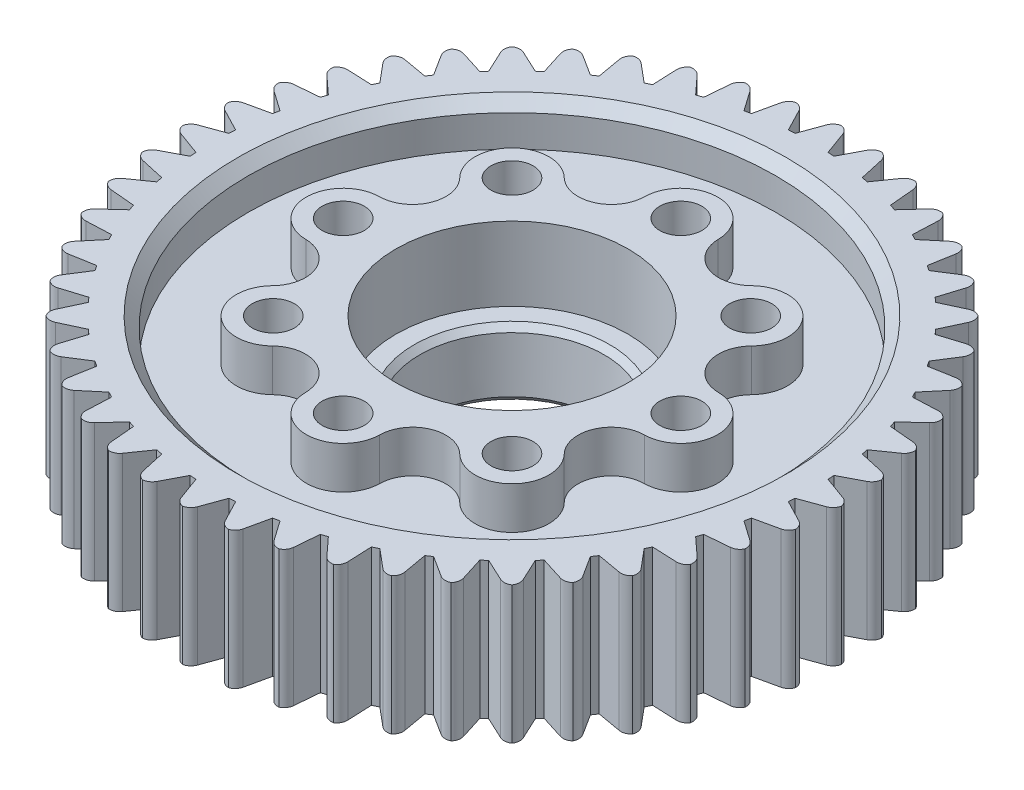
from build123d import *
from OCP.BRepFilletAPI import BRepFilletAPI_MakeChamfer

# Parameters (mm, degrees)
BOSS_EXTRUDE1_DEPTH      = 13
FILLET1_R                = 1
CIRPATTERN1_COUNT        = 48
FILLET1_OF_CIRPATTERN1_R = 1
CUT_EXTRUDE1_DEPTH       = 47.043877534
CUT_EXTRUDE1_DEPTH_BACK  = 47.043877534
SKETCH2_R                = 8.25
SKETCH2_3_R              = 11
SKETCH2_3_R_2            = 8.25
CUT_EXTRUDE2_DEPTH       = 7
SKETCH4_R                = 2
CUT_EXTRUDE4_DEPTH       = 47.043877534
CIRPATTERN2_COUNT        = 8
SKETCH9_R                = 25
CUT_EXTRUDE13_DEPTH      = 4
CHAMFER1_SIZE            = 0.5
CHAMFER1_SIZE2           = 0.461531173
CHAMFER1_SIZE2_2         = 0.550031434
CHAMFER2_SIZE            = 1


# Read off the part's stored shape, not the designer's step: Draft1
with BuildPart() as part:
    # Sketch1 → Boss-Extrude1 (new body)
    with BuildSketch(Plane(origin=(0, 0, 0), x_dir=(1, 0, 0), z_dir=(0, 1, 0))):
        with BuildLine():
            Line((1.560192225, 28.394668628), (0.522526729, 31.245631148))
            ThreePointArc((0.522526729, 31.245631148), (0, 31.25), (-0.522526729, 31.245631148))
            Line((-0.522526729, 31.245631148), (-1.560192225, 28.394668628))
            ThreePointArc((-1.560192225, 28.394668628), (-1.861230023, 28.376526022), (-2.162058489, 28.355191929))
            Line((-2.162058489, 28.355191929), (0, 0))
            Line((0, 0), (1.560192225, 28.394668628))
        make_face()
    boss_extrude1 = extrude(amount=BOSS_EXTRUDE1_DEPTH)

    # Fillet1
    # the kernel refuses this fillet: 1 mm, written as the material it takes off along each edge
    with BuildSketch(Plane(origin=(-0.522526729, -1.768837485, -31.245631148), x_dir=(0.9999854155376374, 0, -0.00540080660816087), z_dir=(0, 1, 0))) as fillet1_piece_1:
        with BuildLine():
            CenterArc((0.696214434, -0.99993592), FILLET1_R, 89.351365841, 70.33918923)
            Line((-0.241617297, -0.652845667), (0, 0))
            ThreePointArc((0, 0), (0.353767497, 0.002002487), (0.707534994, 0))
        make_face()
    extrude(amount=16.537674971, mode=Mode.SUBTRACT)
    with BuildSketch(Plane(origin=(0.522526729, -1.768837485, -31.245631148), x_dir=(0.3420201433256663, 0, 0.9396926207859093), z_dir=(0, 1, 0))) as fillet1_piece_2:
        with BuildLine():
            CenterArc((0.696122391, -1), FILLET1_R, 90, 70.33918923)
            ThreePointArc((-0.2455785, -0.663548768), (-0.124667246, -0.33107934), (0, 0))
            Line((0, 0), (0.696122391, 0))
        make_face()
    extrude(amount=16.537674971, mode=Mode.SUBTRACT)

    # CirPattern1: Boss-Extrude1 ×48 about axis
    cirpattern1_axis = Axis((0, 0, 0), (0, 1, 0))
    for i in range(1, CIRPATTERN1_COUNT):
        add(boss_extrude1.rotate(cirpattern1_axis, i * 360 / CIRPATTERN1_COUNT))

    # Fillet1 of CirPattern1
    # the kernel refuses this fillet: 1 mm, written as the material it takes off along each edge
    with BuildSketch(Plane(origin=(-4.596429698, -1.768837485, -30.910117017), x_dir=(-0.21643961393809757, 0, 0.9762960071199345), z_dir=(0, 1, 0)), Plane(origin=(-8.59168648, -1.768837485, -30.045722215), x_dir=(-0.08715574274765552, 0, 0.9961946980917458), z_dir=(0, 1, 0)), Plane(origin=(-12.439937124, -1.768837485, -28.667236776), x_dir=(0.043619387365339504, 0, 0.9990482215818576), z_dir=(0, 1, 0)), Plane(origin=(-16.075336995, -1.768837485, -26.798246967), x_dir=(0.17364817766693452, 0, 0.9848077530122074), z_dir=(0, 1, 0)), Plane(origin=(-19.435683394, -1.768837485, -24.470731722), x_dir=(0.3007057995042772, 0, 0.9537169507482257), z_dir=(0, 1, 0)), Plane(origin=(-22.46347986, -1.768837485, -21.724515474), x_dir=(0.422618261740705, 0, 0.9063077870366474), z_dir=(0, 1, 0)), Plane(origin=(-25.106919959, -1.768837485, -18.606586742), x_dir=(0.5372996083468274, 0, 0.8433914458128834), z_dir=(0, 1, 0)), Plane(origin=(-27.320773696, -1.768837485, -15.170294152), x_dir=(0.6427876096865415, 0, 0.7660444431189763), z_dir=(0, 1, 0)), Plane(origin=(-29.06716142, -1.768837485, -11.474433624), x_dir=(0.7372773368101273, 0, 0.6755902076156568), z_dir=(0, 1, 0)), Plane(origin=(-30.316201953, -1.768837485, -7.582242355), x_dir=(0.8191520442889958, 0, 0.5735764363510405), z_dir=(0, 1, 0)), Plane(origin=(-31.046523866, -1.768837485, -3.560316817), x_dir=(0.8870108331782227, 0, 0.46174861323503186), z_dir=(0, 1, 0)), Plane(origin=(-31.245631148, -1.768837485, 0.522526729), x_dir=(0.9396926207859095, 0, 0.3420201433256653), z_dir=(0, 1, 0)), Plane(origin=(-30.910117017, -1.768837485, 4.596429698), x_dir=(0.9762960071199345, 0, 0.21643961393809757), z_dir=(0, 1, 0)), Plane(origin=(-30.045722215, -1.768837485, 8.59168648), x_dir=(0.9961946980917459, 0, 0.08715574274765424), z_dir=(0, 1, 0)), Plane(origin=(-28.667236776, -1.768837485, 12.439937124), x_dir=(0.9990482215818577, 0, -0.04361938736533951), z_dir=(0, 1, 0)), Plane(origin=(-26.798246967, -1.768837485, 16.075336995), x_dir=(0.9848077530122079, 0, -0.17364817766693058), z_dir=(0, 1, 0)), Plane(origin=(-24.470731722, -1.768837485, 19.435683394), x_dir=(0.953716950748225, 0, -0.3007057995042789), z_dir=(0, 1, 0)), Plane(origin=(-21.724515474, -1.768837485, 22.46347986), x_dir=(0.9063077870366485, 0, -0.4226182617407028), z_dir=(0, 1, 0)), Plane(origin=(-18.606586742, -1.768837485, 25.106919959), x_dir=(0.8433914458128834, 0, -0.5372996083468274), z_dir=(0, 1, 0)), Plane(origin=(-15.170294152, -1.768837485, 27.320773696), x_dir=(0.7660444431189748, 0, -0.6427876096865431), z_dir=(0, 1, 0)), Plane(origin=(-11.474433624, -1.768837485, 29.06716142), x_dir=(0.6755902076156569, 0, -0.737277336810127), z_dir=(0, 1, 0)), Plane(origin=(-7.582242355, -1.768837485, 30.316201953), x_dir=(0.5735764363510443, 0, -0.8191520442889931), z_dir=(0, 1, 0)), Plane(origin=(-3.560316817, -1.768837485, 31.046523866), x_dir=(0.4617486132350302, 0, -0.8870108331782236), z_dir=(0, 1, 0)), Plane(origin=(0.522526729, -1.768837485, 31.245631148), x_dir=(0.3420201433256653, 0, -0.9396926207859095), z_dir=(0, 1, 0)), Plane(origin=(4.596429698, -1.768837485, 30.910117017), x_dir=(0.21643961393810002, 0, -0.976296007119934), z_dir=(0, 1, 0)), Plane(origin=(8.59168648, -1.768837485, 30.045722215), x_dir=(0.08715574274765468, 0, -0.9961946980917459), z_dir=(0, 1, 0)), Plane(origin=(12.439937124, -1.768837485, 28.667236776), x_dir=(-0.043619387365339726, 0, -0.9990482215818576), z_dir=(0, 1, 0)), Plane(origin=(16.075336995, -1.768837485, 26.798246967), x_dir=(-0.17364817766693363, 0, -0.9848077530122074), z_dir=(0, 1, 0)), Plane(origin=(19.435683394, -1.768837485, 24.470731722), x_dir=(-0.3007057995042743, 0, -0.9537169507482266), z_dir=(0, 1, 0)), Plane(origin=(22.46347986, -1.768837485, 21.724515474), x_dir=(-0.4226182617406989, 0, -0.9063077870366503), z_dir=(0, 1, 0)), Plane(origin=(25.106919959, -1.768837485, 18.606586742), x_dir=(-0.5372996083468274, 0, -0.8433914458128834), z_dir=(0, 1, 0)), Plane(origin=(27.320773696, -1.768837485, 15.170294152), x_dir=(-0.6427876096865437, 0, -0.7660444431189745), z_dir=(0, 1, 0)), Plane(origin=(29.06716142, -1.768837485, 11.474433624), x_dir=(-0.737277336810127, 0, -0.6755902076156569), z_dir=(0, 1, 0)), Plane(origin=(30.316201953, -1.768837485, 7.582242355), x_dir=(-0.8191520442889937, 0, -0.5735764363510434), z_dir=(0, 1, 0)), Plane(origin=(31.046523866, -1.768837485, 3.560316817), x_dir=(-0.8870108331782238, 0, -0.46174861323502986), z_dir=(0, 1, 0)), Plane(origin=(31.245631148, -1.768837485, -0.522526729), x_dir=(-0.9396926207859091, 0, -0.34202014332566666), z_dir=(0, 1, 0)), Plane(origin=(30.910117017, -1.768837485, -4.596429698), x_dir=(-0.976296007119934, 0, -0.21643961393810002), z_dir=(0, 1, 0)), Plane(origin=(30.045722215, -1.768837485, -8.59168648), x_dir=(-0.9961946980917458, 0, -0.08715574274765596), z_dir=(0, 1, 0)), Plane(origin=(28.667236776, -1.768837485, -12.439937124), x_dir=(-0.9990482215818577, 0, 0.04361938736533973), z_dir=(0, 1, 0)), Plane(origin=(26.798246967, -1.768837485, -16.075336995), x_dir=(-0.9848077530122077, 0, 0.1736481776669322), z_dir=(0, 1, 0)), Plane(origin=(24.470731722, -1.768837485, -19.435683394), x_dir=(-0.9537169507482254, 0, 0.3007057995042779), z_dir=(0, 1, 0)), Plane(origin=(21.724515474, -1.768837485, -22.46347986), x_dir=(-0.9063077870366483, 0, 0.42261826174070305), z_dir=(0, 1, 0)), Plane(origin=(18.606586742, -1.768837485, -25.106919959), x_dir=(-0.8433914458128843, 0, 0.5372996083468261), z_dir=(0, 1, 0)), Plane(origin=(15.170294152, -1.768837485, -27.320773696), x_dir=(-0.7660444431189768, 0, 0.6427876096865409), z_dir=(0, 1, 0)), Plane(origin=(11.474433624, -1.768837485, -29.06716142), x_dir=(-0.6755902076156592, 0, 0.7372773368101249), z_dir=(0, 1, 0)), Plane(origin=(7.582242355, -1.768837485, -30.316201953), x_dir=(-0.5735764363510422, 0, 0.8191520442889946), z_dir=(0, 1, 0)), Plane(origin=(3.560316817, -1.768837485, -31.046523866), x_dir=(-0.46174861323503036, 0, 0.8870108331782236), z_dir=(0, 1, 0))) as fillet1_of_cirpattern1_piece_1:
        with BuildLine():
            CenterArc((0.696122391, 1), FILLET1_OF_CIRPATTERN1_R, 199.66081077, 70.33918923)
            ThreePointArc((-0.2455785, 0.663548768), (-0.124667246, 0.33107934), (0, 0))
            Line((0, 0), (0.696122391, 0))
        make_face()
    extrude(amount=16.537674971, mode=Mode.SUBTRACT)
    with BuildSketch(Plane(origin=(-3.560316817, -1.768837485, -31.046523866), x_dir=(-0.9921353484050245, 0, 0.12516968660678457), z_dir=(0, 1, 0)), Plane(origin=(-7.582242355, -1.768837485, -30.316201953), x_dir=(-0.9673095703893142, 0, 0.2535984917802955), z_dir=(0, 1, 0)), Plane(origin=(-11.474433624, -1.768837485, -29.06716142), x_dir=(-0.9259328574353646, 0, 0.3776881564486512), z_dir=(0, 1, 0)), Plane(origin=(-15.170294152, -1.768837485, -27.320773696), x_dir=(-0.8687131765736099, 0, 0.495315472045229), z_dir=(0, 1, 0)), Plane(origin=(-18.606586742, -1.768837485, -25.106919959), x_dir=(-0.7966295724078818, 0, 0.6044678025877271), z_dir=(0, 1, 0)), Plane(origin=(-21.724515474, -1.768837485, -22.46347986), x_dir=(-0.7109154153908119, 0, 0.7032775214378099), z_dir=(0, 1, 0)), Plane(origin=(-24.470731722, -1.768837485, -19.435683394), x_dir=(-0.6130372985134128, 0, 0.7900539669107274), z_dir=(0, 1, 0)), Plane(origin=(-26.798246967, -1.768837485, -16.075336995), x_dir=(-0.5046699434924125, 0, 0.8633123699654519), z_dir=(0, 1, 0)), Plane(origin=(-28.667236776, -1.768837485, -12.439937124), x_dir=(-0.3876675458172975, 0, 0.9217992590146694), z_dir=(0, 1, 0)), Plane(origin=(-30.045722215, -1.768837485, -8.59168648), x_dir=(-0.26403204895151144, 0, 0.9645139071711027), z_dir=(0, 1, 0)), Plane(origin=(-30.910117017, -1.768837485, -4.596429698), x_dir=(-0.1358788905246371, 0, 0.9907254549620665), z_dir=(0, 1, 0)), Plane(origin=(-31.245631148, -1.768837485, -0.522526729), x_dir=(-0.00540080660815091, 0, 0.9999854155376374), z_dir=(0, 1, 0)), Plane(origin=(-31.046523866, -1.768837485, 3.560316817), x_dir=(0.12516968660678457, 0, 0.9921353484050245), z_dir=(0, 1, 0)), Plane(origin=(-30.316201953, -1.768837485, 7.582242355), x_dir=(0.25359849178029426, 0, 0.9673095703893144), z_dir=(0, 1, 0)), Plane(origin=(-29.06716142, -1.768837485, 11.474433624), x_dir=(0.3776881564486521, 0, 0.9259328574353642), z_dir=(0, 1, 0)), Plane(origin=(-27.320773696, -1.768837485, 15.170294152), x_dir=(0.4953154720452301, 0, 0.8687131765736092), z_dir=(0, 1, 0)), Plane(origin=(-25.106919959, -1.768837485, 18.606586742), x_dir=(0.6044678025877279, 0, 0.7966295724078812), z_dir=(0, 1, 0)), Plane(origin=(-22.46347986, -1.768837485, 21.724515474), x_dir=(0.7032775214378076, 0, 0.7109154153908143), z_dir=(0, 1, 0)), Plane(origin=(-19.435683394, -1.768837485, 24.470731722), x_dir=(0.7900539669107263, 0, 0.6130372985134143), z_dir=(0, 1, 0)), Plane(origin=(-16.075336995, -1.768837485, 26.798246967), x_dir=(0.8633123699654537, 0, 0.5046699434924091), z_dir=(0, 1, 0)), Plane(origin=(-12.439937124, -1.768837485, 28.667236776), x_dir=(0.9217992590146694, 0, 0.3876675458172975), z_dir=(0, 1, 0)), Plane(origin=(-8.59168648, -1.768837485, 30.045722215), x_dir=(0.9645139071711034, 0, 0.2640320489515087), z_dir=(0, 1, 0)), Plane(origin=(-4.596429698, -1.768837485, 30.910117017), x_dir=(0.9907254549620664, 0, 0.1358788905246376), z_dir=(0, 1, 0)), Plane(origin=(-0.522526729, -1.768837485, 31.245631148), x_dir=(0.9999854155376374, 0, 0.005400806608150907), z_dir=(0, 1, 0)), Plane(origin=(3.560316817, -1.768837485, 31.046523866), x_dir=(0.9921353484050245, 0, -0.12516968660678457), z_dir=(0, 1, 0)), Plane(origin=(7.582242355, -1.768837485, 30.316201953), x_dir=(0.9673095703893142, 0, -0.25359849178029514), z_dir=(0, 1, 0)), Plane(origin=(11.474433624, -1.768837485, 29.06716142), x_dir=(0.9259328574353635, 0, -0.37768815644865383), z_dir=(0, 1, 0)), Plane(origin=(15.170294152, -1.768837485, 27.320773696), x_dir=(0.8687131765736092, 0, -0.49531547204523013), z_dir=(0, 1, 0)), Plane(origin=(18.606586742, -1.768837485, 25.106919959), x_dir=(0.7966295724078818, 0, -0.6044678025877271), z_dir=(0, 1, 0)), Plane(origin=(21.724515474, -1.768837485, 22.46347986), x_dir=(0.7109154153908143, 0, -0.7032775214378076), z_dir=(0, 1, 0)), Plane(origin=(24.470731722, -1.768837485, 19.435683394), x_dir=(0.6130372985134191, 0, -0.7900539669107226), z_dir=(0, 1, 0)), Plane(origin=(26.798246967, -1.768837485, 16.075336995), x_dir=(0.5046699434924095, 0, -0.8633123699654536), z_dir=(0, 1, 0)), Plane(origin=(28.667236776, -1.768837485, 12.439937124), x_dir=(0.3876675458172991, 0, -0.9217992590146687), z_dir=(0, 1, 0)), Plane(origin=(30.045722215, -1.768837485, 8.59168648), x_dir=(0.26403204895151144, 0, -0.9645139071711027), z_dir=(0, 1, 0)), Plane(origin=(30.910117017, -1.768837485, 4.596429698), x_dir=(0.1358788905246376, 0, -0.9907254549620664), z_dir=(0, 1, 0)), Plane(origin=(31.245631148, -1.768837485, 0.522526729), x_dir=(0.0054008066081508085, 0, -0.9999854155376374), z_dir=(0, 1, 0)), Plane(origin=(31.046523866, -1.768837485, -3.560316817), x_dir=(-0.12516968660678487, 0, -0.9921353484050244), z_dir=(0, 1, 0)), Plane(origin=(30.316201953, -1.768837485, -7.582242355), x_dir=(-0.2535984917802955, 0, -0.9673095703893142), z_dir=(0, 1, 0)), Plane(origin=(29.06716142, -1.768837485, -11.474433624), x_dir=(-0.37768815644865544, 0, -0.9259328574353629), z_dir=(0, 1, 0)), Plane(origin=(27.320773696, -1.768837485, -15.170294152), x_dir=(-0.495315472045229, 0, -0.8687131765736099), z_dir=(0, 1, 0)), Plane(origin=(25.106919959, -1.768837485, -18.606586742), x_dir=(-0.6044678025877269, 0, -0.796629572407882), z_dir=(0, 1, 0)), Plane(origin=(22.46347986, -1.768837485, -21.724515474), x_dir=(-0.7032775214378074, 0, -0.7109154153908145), z_dir=(0, 1, 0)), Plane(origin=(19.435683394, -1.768837485, -24.470731722), x_dir=(-0.7900539669107274, 0, -0.6130372985134128), z_dir=(0, 1, 0)), Plane(origin=(16.075336995, -1.768837485, -26.798246967), x_dir=(-0.8633123699654531, 0, -0.5046699434924102), z_dir=(0, 1, 0)), Plane(origin=(12.439937124, -1.768837485, -28.667236776), x_dir=(-0.92179925901467, 0, -0.3876675458172962), z_dir=(0, 1, 0)), Plane(origin=(8.59168648, -1.768837485, -30.045722215), x_dir=(-0.9645139071711034, 0, -0.26403204895150906), z_dir=(0, 1, 0))) as fillet1_of_cirpattern1_piece_2:
        with BuildLine():
            CenterArc((0.696214434, 0.99993592), FILLET1_OF_CIRPATTERN1_R, 200.309444929, 70.33918923)
            Line((-0.241617297, 0.652845667), (0, 0))
            ThreePointArc((0, 0), (0.353767497, -0.002002487), (0.707534994, 0))
        make_face()
    extrude(amount=16.537674971, mode=Mode.SUBTRACT)
    with BuildSketch(Plane(origin=(4.596429698, -1.768837485, -30.910117017), x_dir=(0.2164396139380992, 0, 0.9762960071199343), z_dir=(0, 1, 0))) as fillet1_of_cirpattern1_piece_3:
        with BuildLine():
            CenterArc((0.696122391, -1), FILLET1_OF_CIRPATTERN1_R, 90, 70.33918923)
            ThreePointArc((-0.2455785, -0.663548768), (-0.124667246, -0.33107934), (0, 0))
            Line((0, 0), (0.696122391, 0))
        make_face()
    extrude(amount=16.537674971, mode=Mode.SUBTRACT)

    # Sketch2 → Cut-Extrude1 (cut, two sides: drawn at the far end of the back side and taken through both)
    with BuildSketch(Plane(origin=(0, 13, 0), x_dir=(1, 0, 0), z_dir=(0, 1, 0)).offset(-CUT_EXTRUDE1_DEPTH_BACK)):
        with Locations(Location((0, 0, 0), (0, 0, 270))):
            Circle(SKETCH2_R)
    extrude(amount=CUT_EXTRUDE1_DEPTH + CUT_EXTRUDE1_DEPTH_BACK, mode=Mode.SUBTRACT)

    # Sketch2<3> → Cut-Extrude2 (cut)
    with BuildSketch(Plane(origin=(0, 13, 0), x_dir=(1, 0, 0), z_dir=(0, 1, 0))):
        with Locations(Location((0, 0, 0), (0, 0, 270))):
            Circle(SKETCH2_3_R)
        with Locations(Location((0, 0, 0), (0, 0, 270))):
            Circle(SKETCH2_3_R_2, mode=Mode.SUBTRACT)
    extrude(amount=-CUT_EXTRUDE2_DEPTH, mode=Mode.SUBTRACT)

    # Sketch4 → Cut-Extrude4 (cut, through all)
    with BuildSketch(Plane(origin=(0, 13, 0), x_dir=(1, 0, 0), z_dir=(0, 1, 0))):
        with Locations(Location((0, 16, 0), (0, 0, 270))):
            Circle(SKETCH4_R)
    cut_extrude4 = extrude(amount=-CUT_EXTRUDE4_DEPTH, mode=Mode.SUBTRACT)

    # CirPattern2: Cut-Extrude4 ×8 about axis
    cirpattern2_axis = Axis((0, 0, 0), (0, 1, 0))
    for i in range(1, CIRPATTERN2_COUNT):
        add(cut_extrude4.rotate(cirpattern2_axis, i * 360 / CIRPATTERN2_COUNT), mode=Mode.SUBTRACT)

    # Sketch9 → Cut-Extrude13 (cut)
    with BuildSketch(Plane.XZ):
        with Locations(Location((0, 0, 0), (0, 0, 270))):
            Circle(SKETCH9_R)
        with BuildLine():
            ThreePointArc((13.821559171, 8.872257085), (13.165283338, 5.453238911), (16.046951365, 3.499685067))
            ThreePointArc((16.046951365, 3.499685067), (18.491418249, 2.458217873), (19.5, 0))
            ThreePointArc((19.5, 0), (18.491418249, -2.458217873), (16.046951365, -3.499685067))
            ThreePointArc((16.046951365, -3.499685067), (13.165283338, -5.453238911), (13.821559171, -8.872257085))
            ThreePointArc((13.821559171, -8.872257085), (14.556198079, -9.996035807), (14.813708499, -11.313708499))
            ThreePointArc((14.813708499, -11.313708499), (12.674759573, -14.538230165), (8.872257085, -13.821559171))
            ThreePointArc((8.872257085, -13.821559171), (5.453238911, -13.165283338), (3.499685067, -16.046951365))
            ThreePointArc((3.499685067, -16.046951365), (0, -19.5), (-3.499685067, -16.046951365))
            ThreePointArc((-3.499685067, -16.046951365), (-5.453238911, -13.165283338), (-8.872257085, -13.821559171))
            ThreePointArc((-8.872257085, -13.821559171), (-13.788582233, -13.788582233), (-13.821559171, -8.872257085))
            ThreePointArc((-13.821559171, -8.872257085), (-13.165283338, -5.453238911), (-16.046951365, -3.499685067))
            ThreePointArc((-16.046951365, -3.499685067), (-19.5, 0), (-16.046951365, 3.499685067))
            ThreePointArc((-16.046951365, 3.499685067), (-13.165283338, 5.453238911), (-13.821559171, 8.872257085))
            ThreePointArc((-13.821559171, 8.872257085), (-13.788582233, 13.788582233), (-8.872257085, 13.821559171))
            ThreePointArc((-8.872257085, 13.821559171), (-5.453238911, 13.165283338), (-3.499685067, 16.046951365))
            ThreePointArc((-3.499685067, 16.046951365), (0, 19.5), (3.499685067, 16.046951365))
            ThreePointArc((3.499685067, 16.046951365), (5.453238911, 13.165283338), (8.872257085, 13.821559171))
            ThreePointArc((8.872257085, 13.821559171), (12.674759573, 14.538230165), (14.813708499, 11.313708499))
            ThreePointArc((14.813708499, 11.313708499), (14.556198079, 9.996035807), (13.821559171, 8.872257085))
        make_face(mode=Mode.SUBTRACT)
    cut_extrude13 = extrude(amount=-CUT_EXTRUDE13_DEPTH, mode=Mode.SUBTRACT)

    # Mirror1: Cut-Extrude13 across plane
    add(cut_extrude13.mirror(Plane(origin=(0, 6.5, 0), x_dir=(0, 0, 1), z_dir=(0, -1, 0))), mode=Mode.SUBTRACT)

    # Draft1 outline → Draft1 (revolve, cut)
    with BuildSketch(Plane.XY):
        Polygon((8.25, 6), (8.25, 0), (8.774931981, 6), align=None)
    revolve(axis=Axis((0, 0, 0), (0, 1, 0)), mode=Mode.SUBTRACT)

    # Chamfer1: one chamfer whose edges measure the first distance from different faces: ONE call of the kernel's chamfer builder (chamfer() names one face for all edges)
    chamfer1_edges_1 = [part.edges().sort_by_distance(p)[0] for p in [
        (-8.25, 0, 0),
    ]]
    chamfer1_side_1 = [part.faces().sort_by_distance(p)[0] for p in [
        (-8.512465991, 3, 0),
    ]]
    chamfer1_edges_2 = [part.edges().sort_by_distance(p)[0] for p in [
        (-8.774931981, 6, 0),
    ]]
    chamfer1_side_2 = [part.faces().sort_by_distance(p)[0] for p in [
        (0, 6, -10.688873016),
    ]]
    chamfer1 = BRepFilletAPI_MakeChamfer(part.part.solid().wrapped)
    for e in chamfer1_edges_1:
        chamfer1.Add(CHAMFER1_SIZE, CHAMFER1_SIZE2, e.wrapped, chamfer1_side_1[0].wrapped)  # the first distance lies on this face
    for e in chamfer1_edges_2:
        chamfer1.Add(CHAMFER1_SIZE, CHAMFER1_SIZE2_2, e.wrapped, chamfer1_side_2[0].wrapped)  # the first distance lies on this face
    add(Compound.cast(chamfer1.Shape()), mode=Mode.REPLACE)

    # Chamfer2
    chamfer2_edges = [part.edges().sort_by_distance(p)[0] for p in [
        (0, 0, 25),
        (0, 13, 25),
    ]]
    chamfer(chamfer2_edges, length=CHAMFER2_SIZE)


solid = part.part
